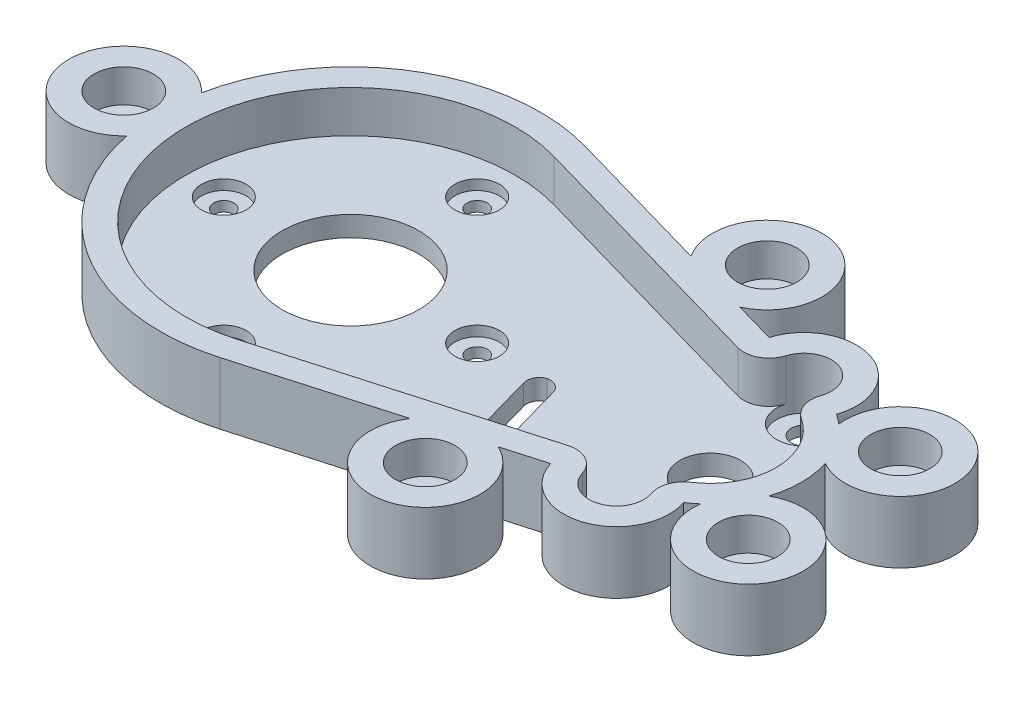
from build123d import *

# Parameters (mm, degrees)
SKETCH1_W               = 200
SKETCH1_H               = 150
SKETCH1_R               = 6
SKETCH1_R_2             = 13.5
SKETCH1_R_3             = 2
SKETCH1_R_4             = 2.5
BOSS_EXTRUDE1_DEPTH     = 4
SKETCH3_W               = 200
SKETCH3_H               = 150
BOSS_EXTRUDE2_DEPTH     = 8.25
SKETCH6_R               = 5.4
CUT_EXTRUDE2_DEPTH      = 8.25
FILLET1_R               = 2.5
FILLET2_R               = 5
SKETCH2_R               = 4.4
SKETCH2_R_2             = 5.4
CUT_EXTRUDE1_DEPTH      = 2
CUT_EXTRUDE3_DEPTH      = 126.598815828
CUT_EXTRUDE3_DEPTH_BACK = 126.598815828
SKETCH8_R               = 3
SKETCH9_R               = 5.85
CUT_EXTRUDE4_DEPTH      = 6.5
CUT_EXTRUDE5_DEPTH      = 126.598815818
CUT_EXTRUDE5_DEPTH_BACK = 126.598815818
SKETCH12_OUTSIDE_W      = 252.06
SKETCH12_OUTSIDE_H      = 202.06


with BuildPart() as part:
    # Sketch1 → Boss-Extrude1 (new body)
    with BuildSketch(Plane(origin=(0, 0, 0), x_dir=(1, 0, 0), z_dir=(0, 1, 0))):
        Rectangle(SKETCH1_W, SKETCH1_H)
        with Locations(Location((35.5, 0, 0), (0, 0, 270))):
            Circle(SKETCH1_R, mode=Mode.SUBTRACT)
        with Locations(Location((-35.5, 0, 0), (0, 0, 270))):
            Circle(SKETCH1_R_2, mode=Mode.SUBTRACT)
        with Locations(Location((-60.5, 0, 0), (0, 0, 270))):
            Circle(SKETCH1_R_3, mode=Mode.SUBTRACT)
        with Locations(Location((-35.5, 25, 0), (0, 0, 270))):
            Circle(SKETCH1_R_3, mode=Mode.SUBTRACT)
        with Locations(Location((-10.5, 0, 0), (0, 0, 270))):
            Circle(SKETCH1_R_3, mode=Mode.SUBTRACT)
        with Locations(Location((-35.5, -25, 0), (0, 0, 270))):
            Circle(SKETCH1_R_3, mode=Mode.SUBTRACT)
        with Locations(Location((35.5, 18.5, 0), (0, 0, 270))):
            Circle(SKETCH1_R_4, mode=Mode.SUBTRACT)
        with Locations(Location((35.5, -18.5, 0), (0, 0, 90))):
            Circle(SKETCH1_R_4, mode=Mode.SUBTRACT)
        Polygon((4.517711304, -15.136418767), (0.159242352, 0.258507293), (4.681501882, 1.538807548), (9.039970835, -13.856118512), (9.584779454, -15.78048427), (5.062519924, -17.060784524), align=None, mode=Mode.SUBTRACT)
    extrude(amount=BOSS_EXTRUDE1_DEPTH)

    # Sketch3 → Boss-Extrude2 (add)
    with BuildSketch(Plane(origin=(0, 4, 0), x_dir=(1, 0, 0), z_dir=(0, 1, 0))):
        Rectangle(SKETCH3_W, SKETCH3_H)
        with BuildLine():
            Line((-26.573943662, 31.250208291), (39.070422535, 12.500083317))
            ThreePointArc((39.070422535, 12.500083317), (48.5, 0), (39.070422535, -12.500083317))
            Line((39.070422535, -12.500083317), (-26.573943662, -31.250208291))
            ThreePointArc((-26.573943662, -31.250208291), (-68, 0), (-26.573943662, 31.250208291))
        make_face(mode=Mode.SUBTRACT)
    extrude(amount=BOSS_EXTRUDE2_DEPTH)

    # Sketch6 → Cut-Extrude2 (cut)
    with BuildSketch(Plane(origin=(0, 12.25, 0), x_dir=(1, 0, 0), z_dir=(0, 1, 0))):
        with Locations((35.5, 18.5)):
            Circle(SKETCH6_R)
        with Locations((35.5, -18.5)):
            Circle(SKETCH6_R)
    extrude(amount=-CUT_EXTRUDE2_DEPTH, mode=Mode.SUBTRACT)

    # Fillet1
    # the kernel refuses this fillet: 2.5 mm, written as the material it adds along each edge
    with BuildSketch(Plane(origin=(9.584779454, 0, 15.78048427), x_dir=(-0.9621828787440704, 0, 0.2724043095323078), z_dir=(0, 1, 0)), Plane(origin=(5.062519924, 0, 17.060784524), x_dir=(-0.2724043095323296, 0, -0.9621828787440644), z_dir=(0, 1, 0)), Plane(origin=(4.681501882, 0, -1.538807548), x_dir=(0.2724043095323091, 0, 0.96218287874407), z_dir=(0, 1, 0))) as fillet1_piece_1:
        with BuildLine():
            CenterArc((FILLET1_R, -FILLET1_R), FILLET1_R, 90, 90)
            Line((0, -FILLET1_R), (0, 0))
            Line((0, 0), (FILLET1_R, 0))
        make_face()
    extrude(amount=4)
    with BuildSketch(Plane(origin=(0.159242352, 0, -0.258507293), x_dir=(0.272404309532306, 0, 0.962182878744071), z_dir=(0, 1, 0))) as fillet1_piece_2:
        with BuildLine():
            CenterArc((FILLET1_R, FILLET1_R), FILLET1_R, 180, 90)
            Line((0, FILLET1_R), (0, 0))
            Line((0, 0), (FILLET1_R, 0))
        make_face()
    extrude(amount=4)

    # Fillet2
    fillet2_edges = [part.edges().sort_by_distance(p)[0] for p in [
        (31.784909874, 8.125, 14.581058133),
        (36.584743308, 8.125, 13.210072594),
        (36.584743308, 8.125, -13.210072594),
        (31.784909874, 8.125, -14.581058133),
    ]]
    fillet(fillet2_edges, radius=FILLET2_R)

    # Sketch2 → Cut-Extrude1 (cut)
    with BuildSketch(Plane(origin=(0, 4, 0), x_dir=(1, 0, 0), z_dir=(0, 1, 0))):
        with Locations(Location((-35.5, 25, 0), (0, 0, 270))):
            Circle(SKETCH2_R)
        with Locations(Location((-10.5, 0, 0), (0, 0, 270))):
            Circle(SKETCH2_R)
        with Locations(Location((-35.5, -25, 0), (0, 0, 270))):
            Circle(SKETCH2_R)
        with Locations(Location((-60.5, 0, 0), (0, 0, 270))):
            Circle(SKETCH2_R)
        with Locations(Location((35.5, 18.5, 0), (0, 0, 270))):
            Circle(SKETCH2_R_2)
        with Locations(Location((35.5, -18.5, 0), (0, 0, 197.105868404))):
            Circle(SKETCH2_R_2)
    extrude(amount=-CUT_EXTRUDE1_DEPTH, mode=Mode.SUBTRACT)

    # Sketch8 → Cut-Extrude3 (cut, two sides: drawn at the far end of the back side and taken through both)
    with BuildSketch(Plane.XZ.offset(-CUT_EXTRUDE3_DEPTH_BACK)):
        with Locations(Location((-80.25, 0, 0), (0, 0, 270))):
            Circle(SKETCH8_R)
        with Locations(Location((58, 15, 0), (0, 0, 270))):
            Circle(SKETCH8_R)
        with Locations(Location((58, -15, 0), (0, 0, 270))):
            Circle(SKETCH8_R)
        with Locations(Location((13, 33.75, 0), (0, 0, 270))):
            Circle(SKETCH8_R)
        with Locations(Location((13, -33.75, 0), (0, 0, 270))):
            Circle(SKETCH8_R)
    extrude(amount=CUT_EXTRUDE3_DEPTH + CUT_EXTRUDE3_DEPTH_BACK, mode=Mode.SUBTRACT)

    # Sketch9 → Cut-Extrude4 (cut)
    with BuildSketch(Plane(origin=(0, 12.25, 0), x_dir=(1, 0, 0), z_dir=(0, 1, 0))):
        with Locations(Location((13, 33.75, 0), (0, 0, 270))):
            Circle(SKETCH9_R)
        with Locations(Location((58, 15, 0), (0, 0, 270))):
            Circle(SKETCH9_R)
        with Locations(Location((58, -15, 0), (0, 0, 270))):
            Circle(SKETCH9_R)
        with Locations(Location((13, -33.75, 0), (0, 0, 270))):
            Circle(SKETCH9_R)
        with Locations(Location((-80.25, 0, 0), (0, 0, 270))):
            Circle(SKETCH9_R)
    extrude(amount=-CUT_EXTRUDE4_DEPTH, mode=Mode.SUBTRACT)

    # Sketch12 outside → Cut-Extrude5 (cut, two sides: drawn at the far end of the back side and taken through both)
    with BuildSketch(Plane(origin=(0, 12.25, 0), x_dir=(1, 0, 0), z_dir=(0, 1, 0)).offset(-CUT_EXTRUDE5_DEPTH_BACK)):
        Rectangle(SKETCH12_OUTSIDE_W, SKETCH12_OUTSIDE_H)
        with BuildLine():
            Line((3.977446341, 27.723722089), (-25.200704225, 36.057932644))
            ThreePointArc((-25.200704225, 36.057932644), (-55.024015532, 32.016602217), (-72.271955307, 7.353455166))
            ThreePointArc((-72.271955307, 7.353455166), (-91.1, 0), (-72.271955307, -7.353455166))
            ThreePointArc((-72.271955307, -7.353455166), (-55.024015532, -32.016602217), (-25.200704225, -36.057932644))
            Line((-25.200704225, -36.057932644), (3.977446341, -27.723722089))
            ThreePointArc((3.977446341, -27.723722089), (15.979929577, -44.182761845), (17.478470354, -23.867398961))
            Line((17.478470354, -23.867398961), (25.56006591, -21.559037476))
            ThreePointArc((25.56006591, -21.559037476), (38.738291539, -28.382988815), (45.322811211, -15.083513514))
            ThreePointArc((45.322811211, -15.083513514), (46.302433123, -14.398174837), (47.234399361, -13.649317625))
            ThreePointArc((47.234399361, -13.649317625), (67.027745694, -21.018497129), (52.612600639, -5.582015708))
            ThreePointArc((52.612600639, -5.582015708), (53.5, 0), (52.612600639, 5.582015708))
            ThreePointArc((52.612600639, 5.582015708), (67.027745694, 21.018497129), (47.234399361, 13.649317625))
            ThreePointArc((47.234399361, 13.649317625), (46.302433123, 14.398174837), (45.322811211, 15.083513514))
            ThreePointArc((45.322811211, 15.083513514), (38.738291539, 28.382988815), (25.56006591, 21.559037476))
            Line((25.56006591, 21.559037476), (17.478470354, 23.867398961))
            ThreePointArc((17.478470354, 23.867398961), (15.979929577, 44.182761845), (3.977446341, 27.723722089))
        make_face(mode=Mode.SUBTRACT)
    extrude(amount=CUT_EXTRUDE5_DEPTH + CUT_EXTRUDE5_DEPTH_BACK, mode=Mode.SUBTRACT)


solid = part.part
